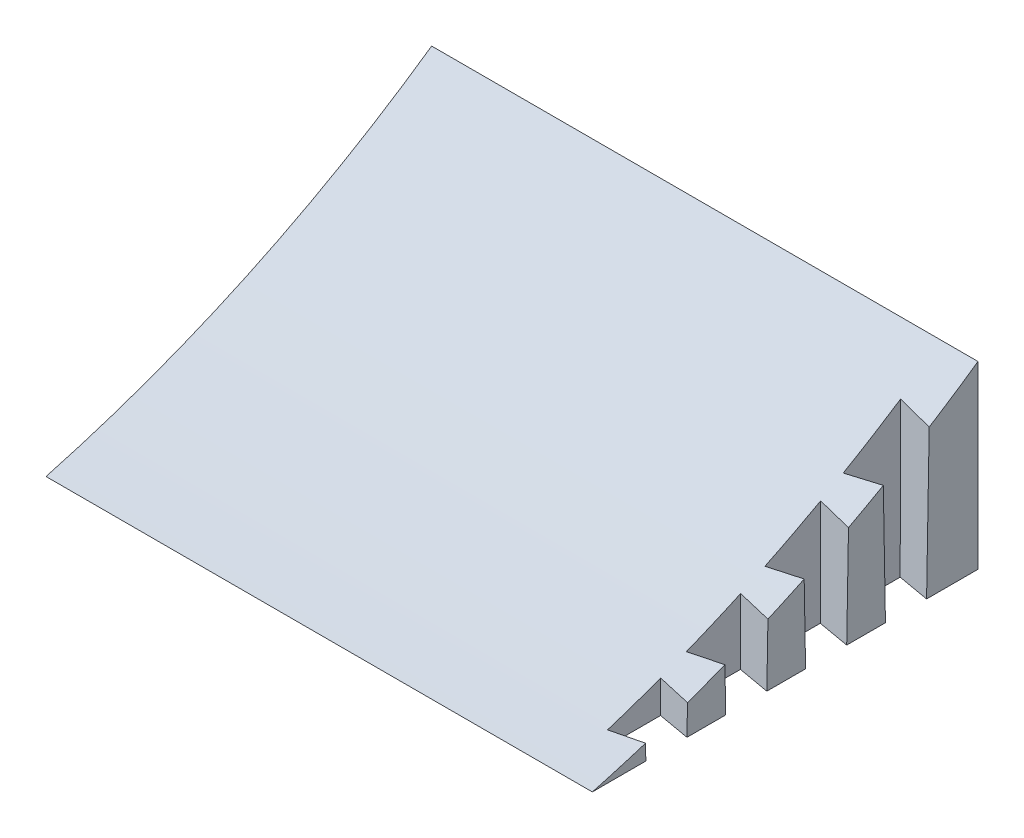
from build123d import *

# Parameters (mm, degrees)
BOSS_EXTRUDE1_DEPTH          = 134.9375
SKETCH4_W                    = 25.4
SKETCH4_H                    = 19.05
CUT_EXTRUDE1_DEPTH           = 6.35
SKETCH5_R                    = 2.921
CUT_EXTRUDE2_DEPTH           = 25.4
CUT_EXTRUDE3_DEPTH           = 38.1
CUT_EXTRUDE3_DRAFT           = 1
CUT_EXTRUDE3_PROFILE_2_DEPTH = 38.1
CUT_EXTRUDE3_PROFILE_2_DRAFT = 1
CUT_EXTRUDE3_PROFILE_3_DEPTH = 38.1
CUT_EXTRUDE3_PROFILE_3_DRAFT = 1
CUT_EXTRUDE3_PROFILE_4_DEPTH = 38.1
CUT_EXTRUDE3_PROFILE_4_DRAFT = 1


with BuildPart() as part:
    # Sketch3 → Boss-Extrude1 (new body)
    with BuildSketch(Plane(origin=(0, 0, 0), x_dir=(0, 0, -1), z_dir=(1, 0, 0))):
        with BuildLine():
            Line((0, 0), (95.25, 0))
            Line((95.25, 0), (95.25, 44.45))
            ThreePointArc((95.25, 44.45), (49.555547135, 18.088113282), (0, 0))
        make_face()
    extrude(amount=BOSS_EXTRUDE1_DEPTH)

    # Sketch4 → Cut-Extrude1 (cut)
    with BuildSketch(Plane.ZY):
        with Locations((-82.55, 15.875)):
            Rectangle(SKETCH4_W, SKETCH4_H)
    extrude(amount=-CUT_EXTRUDE1_DEPTH, mode=Mode.SUBTRACT)

    # Sketch5 → Cut-Extrude2 (cut)
    with BuildSketch(Plane.ZY.offset(-6.35)):
        with Locations((-82.55, 15.875)):
            Circle(SKETCH5_R)
    extrude(amount=-CUT_EXTRUDE2_DEPTH, mode=Mode.SUBTRACT)


with BuildPart() as cut_extrude3_tool:
    # Sketch6 → Cut-Extrude3 (with draft: the straight prism first)
    with BuildSketch(Plane.XZ):
        Polygon((134.9375, -82.55), (134.9375, -72.39), (127.014719298, -70.993), (127.014719298, -83.947), align=None)
    extrude(amount=-CUT_EXTRUDE3_DEPTH)
    # Cut-Extrude3: the draft: its side faces are tilted about the plane it starts from
    cut_extrude3_sides = [cut_extrude3_tool.faces().sort_by_distance(p)[0] for p in [
        (134.9375, 19.05, -77.47),
        (130.976109649, 19.05, -71.6915),
        (127.014719298, 19.05, -77.47),
        (130.976109649, 19.05, -83.2485),
    ]]
    draft(cut_extrude3_sides, Plane.XZ, CUT_EXTRUDE3_DRAFT)


with BuildPart() as part_1:
    add(part.part)

    # Cut-Extrude3: cut by cut_extrude3_tool
    add(cut_extrude3_tool.part, mode=Mode.SUBTRACT)


with BuildPart() as cut_extrude3_profile_2_tool:
    # Sketch6 → Cut-Extrude3 profile 2 (with draft: the straight prism first)
    with BuildSketch(Plane.XZ):
        Polygon((134.9375, -62.822666667), (134.9375, -52.662666667), (127.014719298, -51.265666667), (127.014719298, -64.219666667), align=None)
    extrude(amount=-CUT_EXTRUDE3_PROFILE_2_DEPTH)
    # Cut-Extrude3 profile 2: the draft: its side faces are tilted about the plane it starts from
    cut_extrude3_profile_2_sides = [cut_extrude3_profile_2_tool.faces().sort_by_distance(p)[0] for p in [
        (134.9375, 19.05, -57.742666667),
        (130.976109649, 19.05, -51.964166667),
        (127.014719298, 19.05, -57.742666667),
        (130.976109649, 19.05, -63.521166667),
    ]]
    draft(cut_extrude3_profile_2_sides, Plane.XZ, CUT_EXTRUDE3_PROFILE_2_DRAFT)


with BuildPart() as part_2:
    add(part_1.part)

    # Cut-Extrude3 profile 2: cut by cut_extrude3_profile_2_tool
    add(cut_extrude3_profile_2_tool.part, mode=Mode.SUBTRACT)


with BuildPart() as cut_extrude3_profile_3_tool:
    # Sketch6 → Cut-Extrude3 profile 3 (with draft: the straight prism first)
    with BuildSketch(Plane.XZ):
        Polygon((134.9375, -43.095333333), (134.9375, -32.935333333), (127.014719298, -31.538333333), (127.014719298, -44.492333333), align=None)
    extrude(amount=-CUT_EXTRUDE3_PROFILE_3_DEPTH)
    # Cut-Extrude3 profile 3: the draft: its side faces are tilted about the plane it starts from
    cut_extrude3_profile_3_sides = [cut_extrude3_profile_3_tool.faces().sort_by_distance(p)[0] for p in [
        (134.9375, 19.05, -38.015333333),
        (130.976109649, 19.05, -32.236833333),
        (127.014719298, 19.05, -38.015333333),
        (130.976109649, 19.05, -43.793833333),
    ]]
    draft(cut_extrude3_profile_3_sides, Plane.XZ, CUT_EXTRUDE3_PROFILE_3_DRAFT)


with BuildPart() as part_3:
    add(part_2.part)

    # Cut-Extrude3 profile 3: cut by cut_extrude3_profile_3_tool
    add(cut_extrude3_profile_3_tool.part, mode=Mode.SUBTRACT)


with BuildPart() as cut_extrude3_profile_4_tool:
    # Sketch6 → Cut-Extrude3 profile 4 (with draft: the straight prism first)
    with BuildSketch(Plane.XZ):
        Polygon((134.9375, -23.368), (134.9375, -13.208), (127.014719298, -11.811), (127.014719298, -24.765), align=None)
    extrude(amount=-CUT_EXTRUDE3_PROFILE_4_DEPTH)
    # Cut-Extrude3 profile 4: the draft: its side faces are tilted about the plane it starts from
    cut_extrude3_profile_4_sides = [cut_extrude3_profile_4_tool.faces().sort_by_distance(p)[0] for p in [
        (134.9375, 19.05, -18.288),
        (130.976109649, 19.05, -12.5095),
        (127.014719298, 19.05, -18.288),
        (130.976109649, 19.05, -24.0665),
    ]]
    draft(cut_extrude3_profile_4_sides, Plane.XZ, CUT_EXTRUDE3_PROFILE_4_DRAFT)


with BuildPart() as part_4:
    add(part_3.part)

    # Cut-Extrude3 profile 4: cut by cut_extrude3_profile_4_tool
    add(cut_extrude3_profile_4_tool.part, mode=Mode.SUBTRACT)


solid = part_4.part
